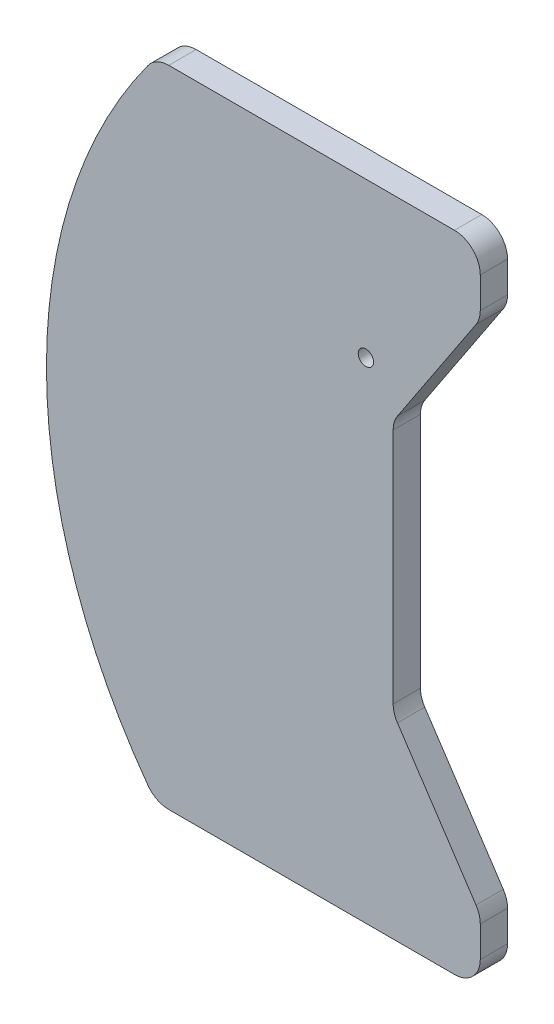
from build123d import *

# Parameters (mm, degrees)
SKETCH1_R           = 0.889
BOSS_EXTRUDE1_DEPTH = 3.175
FILLET1_R           = 3
BOSS_EXTRUDE3_DEPTH = 0.01


with BuildPart() as part:
    # Sketch1 → Boss-Extrude1 (new body)
    with BuildSketch(Plane.XY):
        with BuildLine():
            Line((-15.10903611, 37.5), (-52.85903611, 37.5))
            ThreePointArc((-52.85903611, 37.5), (-65.59, 0), (-52.85903611, -37.5))
            Line((-52.85903611, -37.5), (-15.10903611, -37.5))
            Line((-15.10903611, -37.5), (-15.10903611, -30))
            Line((-15.10903611, -30), (-25.245, -14.706863489))
            Line((-25.245, -14.706863489), (-25.245, 14.706863489))
            Line((-25.245, 14.706863489), (-15.10903611, 30))
            Line((-15.10903611, 30), (-15.10903611, 37.5))
        make_face()
        with Locations((-28.42, 19.5)):
            Circle(SKETCH1_R, mode=Mode.SUBTRACT)
    extrude(amount=BOSS_EXTRUDE1_DEPTH)

    # Fillet1
    fillet1_edges = [part.edges().sort_by_distance(p)[0] for p in [
        (-15.10903611, -30, 1.5875),
        (-15.10903611, 30, 1.5875),
        (-25.245, -14.706863489, 1.5875),
        (-25.245, 14.706863489, 1.5875),
        (-15.10903611, 37.5, 1.5875),
        (-52.85903611, 37.5, 1.5875),
        (-52.85903611, -37.5, 1.5875),
        (-15.10903611, -37.5, 1.5875),
    ]]
    fillet(fillet1_edges, radius=FILLET1_R)

    # Sketch3 → Boss-Extrude3 (add)
    with BuildSketch(Plane(origin=(0, 0, 0), x_dir=(-1, 0, 0), z_dir=(0, 0, -1))):
        with BuildLine():
            ThreePointArc((42.612322986, -7.62), (38.47668036, -23.377704209), (30.354516642, -37.5))
            Line((30.354516642, -37.5), (47.606630303, -37.5))
            Line((47.606630303, -37.5), (51.356630303, -37.5))
            ThreePointArc((51.356630303, -37.5), (52.716945165, -37.173863025), (53.781494045, -36.266362318))
            ThreePointArc((53.781494045, -36.266362318), (65.59, 0), (53.781494045, 36.266362318))
            ThreePointArc((53.781494045, 36.266362318), (52.716945165, 37.173863025), (51.356630303, 37.5))
            Line((51.356630303, 37.5), (47.606630303, 37.5))
            Line((47.606630303, 37.5), (30.354516642, 37.5))
            ThreePointArc((30.354516642, 37.5), (38.47668036, 23.377704209), (42.612322986, 7.62))
            ThreePointArc((42.612322986, 7.62), (43.085480531, 0), (42.612322986, -7.62))
        make_face()
    extrude(amount=BOSS_EXTRUDE3_DEPTH)


solid = part.part
